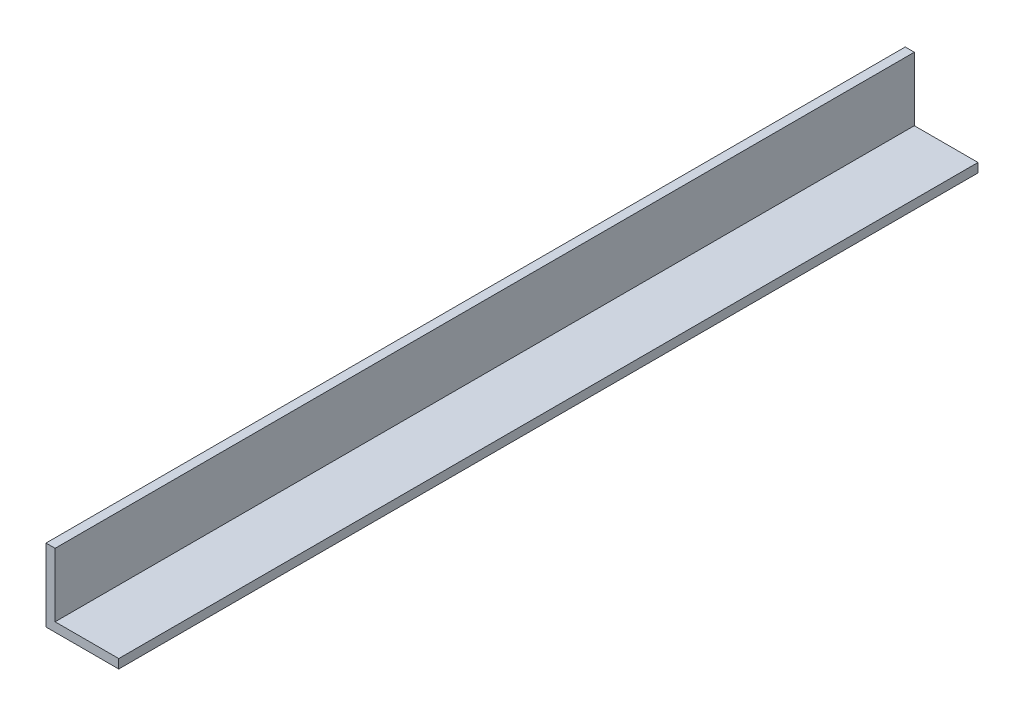
from build123d import *

# Parameters (mm, degrees)
BOSS_EXTRUDE1_DEPTH = 150


with BuildPart() as part:
    # Sketch1 → Boss-Extrude1 (new, symmetric)
    with BuildSketch(Plane.XY):
        Polygon((0, 25.4), (0, 0), (25.4, 0), (25.4, 3.175), (3.175, 3.175), (3.175, 25.4), align=None)
    extrude(amount=BOSS_EXTRUDE1_DEPTH, both=True)


solid = part.part
